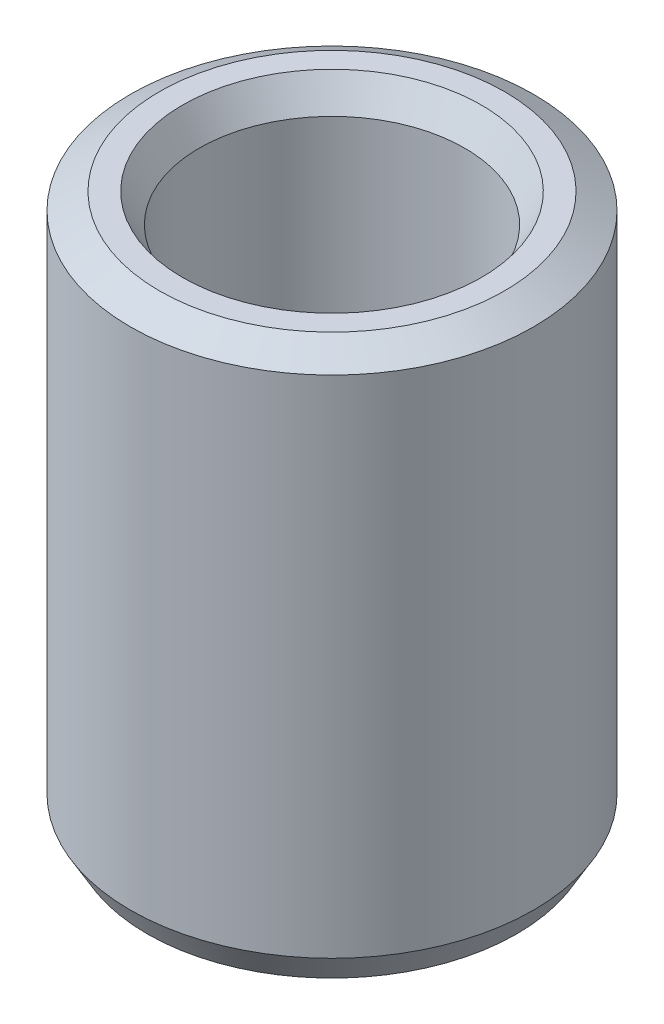
from build123d import *
from OCP.BRepFilletAPI import BRepFilletAPI_MakeChamfer

# Parameters (mm, degrees)
SKETCH1_R           = 32.5
BOSS_EXTRUDE1_DEPTH = 88.815571102
SKETCH2_R           = 21.400260625
CUT_EXTRUDE1_DEPTH  = 101.003528288
CHAMFER1_SIZE       = 2.696189205
CHAMFER1_SIZE2      = 4.669936689


with BuildPart() as part:
    # Sketch1 → Boss-Extrude1 (new body)
    with BuildSketch(Plane(origin=(0, 0, 0), x_dir=(1, 0, 0), z_dir=(0, 1, 0))):
        Circle(SKETCH1_R)
    extrude(amount=BOSS_EXTRUDE1_DEPTH)

    # Sketch2 → Cut-Extrude1 (cut, through all)
    with BuildSketch(Plane(origin=(0, 0, 0), x_dir=(1, 0, 0), z_dir=(0, 1, 0))):
        Circle(SKETCH2_R)
    extrude(amount=CUT_EXTRUDE1_DEPTH, mode=Mode.SUBTRACT)

    # Chamfer1: one chamfer whose edges measure the first distance from different faces: ONE call of the kernel's chamfer builder (chamfer() names one face for all edges)
    chamfer1_edges_1 = [part.edges().sort_by_distance(p)[0] for p in [
        (-21.400260625, 88.815571102, 0),
    ]]
    chamfer1_side_1 = [part.faces().sort_by_distance(p)[0] for p in [
        (-31.580761184, 88.815571102, 0),
    ]]
    chamfer1_edges_2 = [part.edges().sort_by_distance(p)[0] for p in [
        (-21.400260625, 0, 0),
    ]]
    chamfer1_side_2 = [part.faces().sort_by_distance(p)[0] for p in [
        (-21.400260625, 44.407785551, 0),
    ]]
    chamfer1_edges_3 = [part.edges().sort_by_distance(p)[0] for p in [
        (-32.5, 0, 0),
    ]]
    chamfer1_side_3 = [part.faces().sort_by_distance(p)[0] for p in [
        (-31.580761184, 0, 0),
    ]]
    chamfer1_edges_4 = [part.edges().sort_by_distance(p)[0] for p in [
        (-32.5, 88.815571102, 0),
    ]]
    chamfer1_side_4 = [part.faces().sort_by_distance(p)[0] for p in [
        (-32.5, 44.407785551, 0),
    ]]
    chamfer1 = BRepFilletAPI_MakeChamfer(part.part.solid().wrapped)
    for e in chamfer1_edges_1:
        chamfer1.Add(CHAMFER1_SIZE, CHAMFER1_SIZE2, e.wrapped, chamfer1_side_1[0].wrapped)  # the first distance lies on this face
    for e in chamfer1_edges_2:
        chamfer1.Add(CHAMFER1_SIZE, CHAMFER1_SIZE2, e.wrapped, chamfer1_side_2[0].wrapped)  # the first distance lies on this face
    for e in chamfer1_edges_3:
        chamfer1.Add(CHAMFER1_SIZE, CHAMFER1_SIZE2, e.wrapped, chamfer1_side_3[0].wrapped)  # the first distance lies on this face
    for e in chamfer1_edges_4:
        chamfer1.Add(CHAMFER1_SIZE, CHAMFER1_SIZE2, e.wrapped, chamfer1_side_4[0].wrapped)  # the first distance lies on this face
    add(Compound.cast(chamfer1.Shape()), mode=Mode.REPLACE)


solid = part.part
